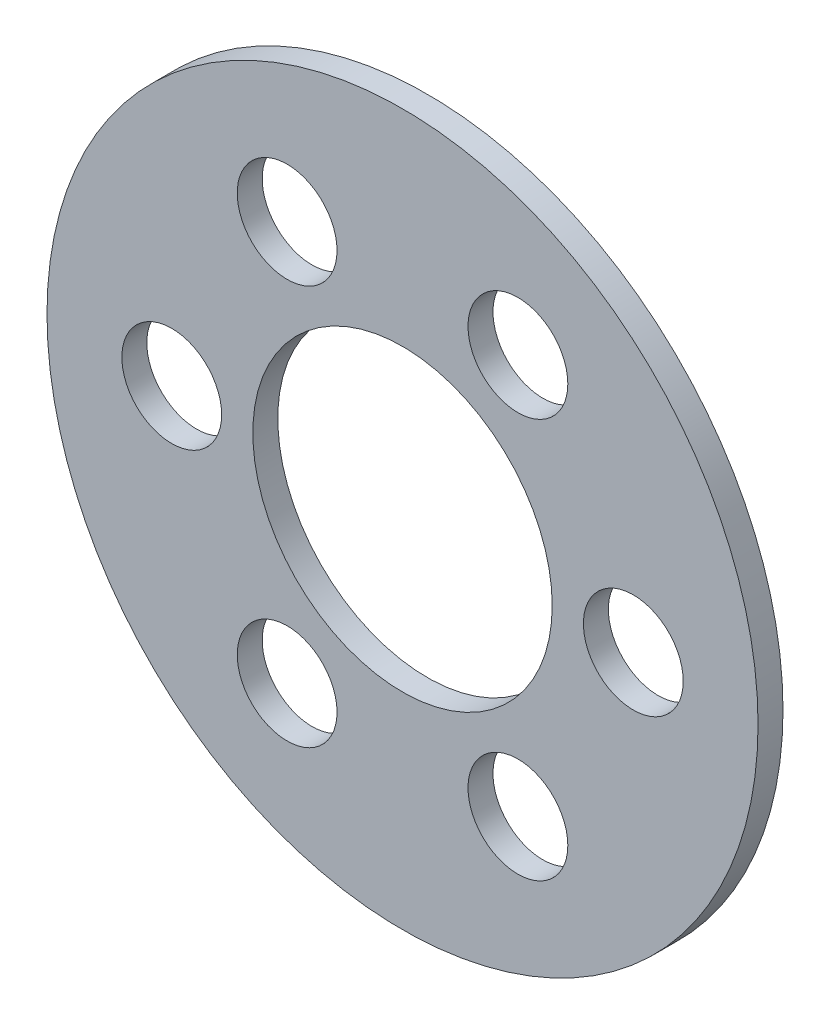
from build123d import *

# Parameters (mm, degrees)
SKIZZE1_R                       = 14.25
SKIZZE1_R_2                     = 2
SKIZZE1_R_3                     = 6
AUFSATZ_LINEAR_AUSTRAGEN1_DEPTH = 1


with BuildPart() as part:
    # Skizze1 → Aufsatz-Linear austragen1 (new body)
    with BuildSketch(Plane.XY):
        Circle(SKIZZE1_R)
        with Locations((4.625, 8.010734985)):
            Circle(SKIZZE1_R_2, mode=Mode.SUBTRACT)
        with Locations((-4.625, -8.010734985)):
            Circle(SKIZZE1_R_2, mode=Mode.SUBTRACT)
        with Locations((4.625, -8.010734985)):
            Circle(SKIZZE1_R_2, mode=Mode.SUBTRACT)
        with Locations((-9.25, 0)):
            Circle(SKIZZE1_R_2, mode=Mode.SUBTRACT)
        with Locations((-4.625, 8.010734985)):
            Circle(SKIZZE1_R_2, mode=Mode.SUBTRACT)
        Circle(SKIZZE1_R_3, mode=Mode.SUBTRACT)
        with Locations((9.25, 0)):
            Circle(SKIZZE1_R_2, mode=Mode.SUBTRACT)
    extrude(amount=AUFSATZ_LINEAR_AUSTRAGEN1_DEPTH)


solid = part.part
